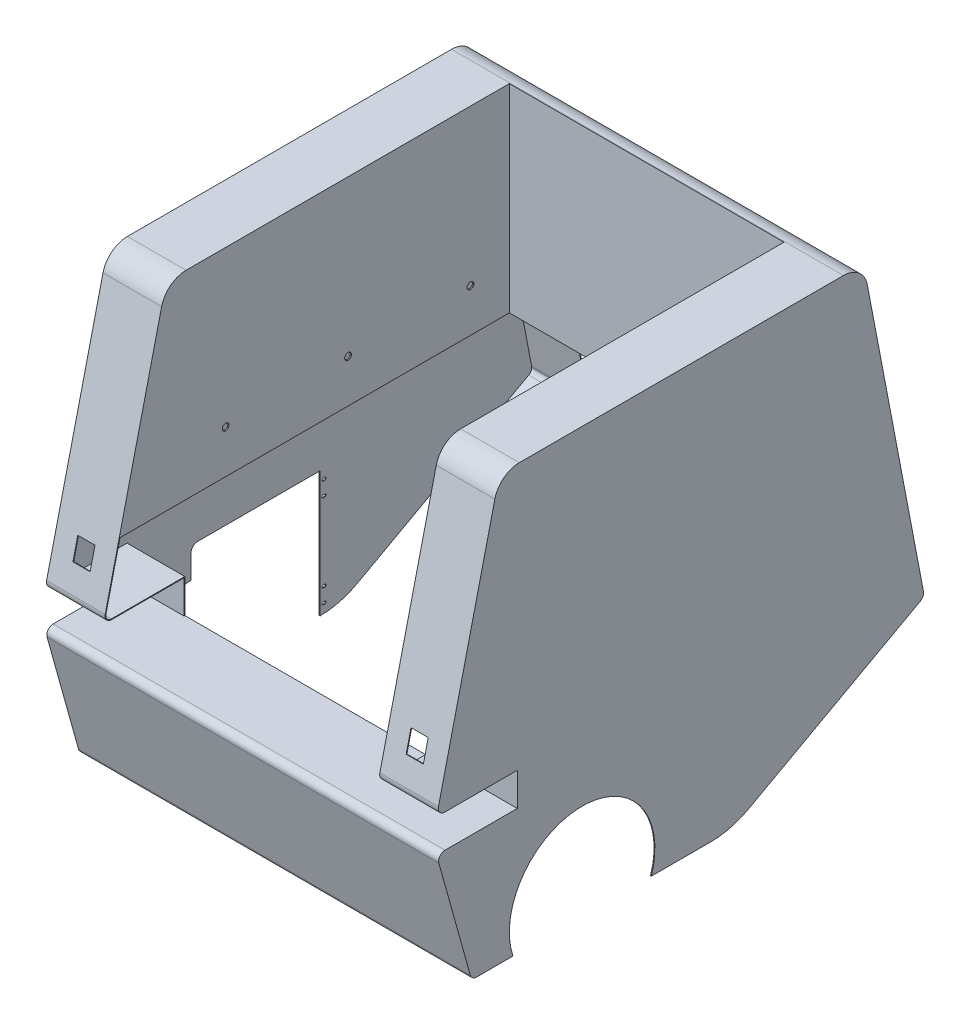
from build123d import *
from build123d.topology import SkipClean

# Parameters (mm, degrees)
EXTRUDE_1_DEPTH                  = 640
SHELL_1_T                        = 1.2
CUT_EXTRUDE_1_REACH              = 962.331
EXTRUDE_START                    = 590
EXTRUDE_2_DEPTH                  = 590
CUT_EXTRUDE_2_DEPTH              = 1.2
CUT_EXTRUDE_3_REACH              = 961.835
SKETCH_5_R                       = 110
SKETCH_6_W                       = 415.2
SKETCH_6_H                       = 302.2
CUT_EXTRUDE_4_DEPTH              = 627.8
SKETCH_7_W                       = 415.2
SKETCH_7_H                       = 2.4
EXTRUDE_3_DEPTH                  = 591.557827
CUT_EXTRUDE_5_DEPTH              = 812.221810018
CUT_EXTRUDE_5_DEPTH_BACK         = 812.221810018
SKETCH_10_W                      = 415.2
SKETCH_10_H                      = 1.2
EXTRUDE_4_DEPTH                  = 299.8
EXTRUDE_START_2                  = -2.4
SKETCH_10_3_W                    = 1.2
SKETCH_10_3_H                    = 490
EXTRUDE_7_DEPTH                  = 301
EXTRUDE_8_DEPTH                  = 1.2
SKETCH_15_W                      = 420
SKETCH_15_H                      = 239.052703248
CUT_EXTRUDE_6_DEPTH              = 132.2
SKETCH_18_W                      = 415.2
SKETCH_18_H                      = 626.6
CUT_EXTRUDE_7_DEPTH              = 151.4
CUT_EXTRUDE_8_REACH              = 961.835
CUT_EXTRUDE_9_REACH              = 984.925
SKETCH_20_W                      = 420
SKETCH_20_H                      = 0.229458581
CUT_EXTRUDE_10_REACH             = 984.925
CUT_EXTRUDE_11_REACH             = 984.925
CUT_EXTRUDE_14_REACH             = 996.76
CUT_EXTRUDE_15_REACH             = 909.833
CUT_EXTRUDE_15_DIRECTION_2_REACH = 909.833


# Read off the part's stored shape, not the designer's step: M5 접시 머리 나사용 카운터싱크1
with BuildPart() as part:
    # 스케치1 → 보스-돌출1 (new body)
    with BuildSketch(Plane(origin=(0, 0, 0), x_dir=(1, 0, 0), z_dir=(0, 1, 0))):
        Polygon((-295, 336), (-295, -336), (295, -336), (295, 336), (295, 399), (-295, 399), align=None)
    extrude(amount=EXTRUDE_1_DEPTH)

    # 쉘1
    shell_1_openings = [part.faces().sort_by_distance(p)[0] for p in [
        (0, 0, -31.5),
    ]]
    offset(amount=SHELL_1_T, openings=shell_1_openings, kind=Kind.INTERSECTION)

    # 스케치2 → 컷-돌출1 (cut, up to next)
    with BuildSketch(Plane(origin=(296.2, 0, 0), x_dir=(0, 0, -1), z_dir=(1, 0, 0)), mode=Mode.PRIVATE) as cut_extrude_1_sk1:
        with BuildLine():
            Line((-337.2, 0), (-276.86455402, 0))
            ThreePointArc((-276.86455402, 0), (-282.70692611, 1.966564113), (-286.170957947, 7.065698302))
            Line((-286.170957947, 7.065698302), (-333.780749054, 177.742307929))
            ThreePointArc((-333.780749054, 177.742307929), (-332.169476201, 186.180676903), (-324.474345127, 190))
            Line((-324.474345127, 190), (-215.2, 190))
            Line((-215.2, 190), (-215.2, 240))
            Line((-215.2, 240), (-324.983347106, 240))
            ThreePointArc((-324.983347106, 240), (-332.561522942, 243.668398525), (-334.385062863, 251.887923992))
            Line((-334.385062863, 251.887923992), (-249.112541007, 612.007247872))
            ThreePointArc((-249.112541007, 612.007247872), (-235.7305783, 633.019791681), (-212.2, 641.2))
            Line((-212.2, 641.2), (-337.2, 641.2))
            Line((-337.2, 641.2), (-337.2, 0))
        make_face()
    cut_extrude_1_tool1 = extrude(cut_extrude_1_sk1.sketch, amount=-CUT_EXTRUDE_1_REACH, mode=Mode.PRIVATE) & part.part
    # 스케치2 → 컷-돌출1 (cut, up to next)
    with BuildSketch(Plane(origin=(296.2, 0, 0), x_dir=(0, 0, -1), z_dir=(1, 0, 0)), mode=Mode.PRIVATE) as cut_extrude_1_sk2:
        with BuildLine():
            ThreePointArc((134.117581208, 14.40086523), (106.864819251, 3.657218987), (77.8, 0))
            Line((77.8, 0), (400.2, 0))
            Line((400.2, 0), (400.2, 641.2))
            Line((400.2, 641.2), (277.8, 641.2))
            ThreePointArc((277.8, 641.2), (301.217923614, 632.771933562), (313.894196537, 611.353634026))
            Line((313.894196537, 611.353634026), (398.832004547, 167.154208573))
            ThreePointArc((398.832004547, 167.154208573), (398.054971056, 161.011376377), (393.810244486, 156.503553755))
            Line((393.810244486, 156.503553755), (134.117581208, 14.40086523))
        make_face()
    cut_extrude_1_tool2 = extrude(cut_extrude_1_sk2.sketch, amount=-CUT_EXTRUDE_1_REACH, mode=Mode.PRIVATE) & part.part
    add(cut_extrude_1_tool1.solids().sort_by_distance((296.2, 638.143736, 239.782915))[0], mode=Mode.SUBTRACT)
    add(cut_extrude_1_tool2.solids().sort_by_distance((296.2, 7.176902, -239))[0], mode=Mode.SUBTRACT)

    # 스케치3 → 보스-돌출2 (add)
    with SkipClean():  # the faces are left unmerged after this step: merging them gives an invalid solid
        with BuildSketch(Plane(origin=(-295, 0, 0), x_dir=(0, 0, -1), z_dir=(1, 0, 0)).offset(EXTRUDE_START)):
            with BuildLine():
                Line((-333.217352778, 251.611422352), (-247.944830922, 611.730746231))
                ThreePointArc((-247.944830922, 611.730746231), (-234.986200025, 632.078568549), (-212.2, 640))
                Line((-212.2, 640), (-221.665718242, 640))
                ThreePointArc((-221.665718242, 640), (-239.285683962, 629.824185623), (-249.112541007, 612.007247872))
                Line((-249.112541007, 612.007247872), (-334.385062863, 251.887923992))
                ThreePointArc((-334.385062863, 251.887923992), (-332.561522942, 243.668398525), (-324.983347106, 240))
                Line((-324.983347106, 240), (-215.2, 240))
                Line((-215.2, 240), (-215.2, 190))
                Line((-215.2, 190), (-324.474345127, 190))
                ThreePointArc((-324.474345127, 190), (-332.169476201, 186.180676903), (-333.780749054, 177.742307929))
                Line((-333.780749054, 177.742307929), (-286.170957947, 7.065698302))
                ThreePointArc((-286.170957947, 7.065698302), (-282.70692611, 1.966564113), (-276.86455402, 0))
                Line((-276.86455402, 0), (-276.86455402, 1.2))
                ThreePointArc((-276.86455402, 1.2), (-281.98129294, 2.922313297), (-285.015085764, 7.388125805))
                Line((-285.015085764, 7.388125805), (-332.62487687, 178.064735433))
                ThreePointArc((-332.62487687, 178.064735433), (-331.213727017, 185.455043733), (-324.474345127, 188.8))
                Line((-324.474345127, 188.8), (-214, 188.8))
                Line((-214, 188.8), (-214, 241.2))
                Line((-214, 241.2), (-324.983347106, 241.2))
                ThreePointArc((-324.983347106, 241.2), (-331.62029981, 244.4127768), (-333.217352778, 251.611422352))
            make_face()
            with BuildLine():
                Line((287.114264573, 640), (277.8, 640))
                ThreePointArc((277.8, 640), (300.453217917, 631.847149697), (312.715550721, 611.128258696))
                Line((312.715550721, 611.128258696), (397.653358731, 166.928833243))
                ThreePointArc((397.653358731, 166.928833243), (397.748498306, 166.314290682), (397.8, 165.694563586))
                Line((397.8, 165.694563586), (397.8, 164.857598061))
                ThreePointArc((397.8, 164.857598061), (396.471214792, 160.610288461), (393.234209877, 157.556257003))
                Line((393.234209877, 157.556257003), (291.705150205, 102))
                Line((291.705150205, 102), (292.281184814, 100.947296752))
                Line((292.281184814, 100.947296752), (393.810244486, 156.503553755))
                ThreePointArc((393.810244486, 156.503553755), (397.496460029, 159.986539192), (399, 164.82996155))
                Line((399, 164.82996155), (399, 165.722200097))
                ThreePointArc((399, 165.722200097), (398.941844785, 166.441236038), (398.832004547, 167.154208573))
                Line((398.832004547, 167.154208573), (313.894196537, 611.353634026))
                ThreePointArc((313.894196537, 611.353634026), (304.644657867, 629.547477669), (287.114264573, 640))
            make_face()
        extrude(amount=-EXTRUDE_2_DEPTH)

    # 스케치4 → 컷-돌출2 (cut)
    with SkipClean():  # the faces are left unmerged after this step: merging them gives an invalid solid
        with BuildSketch(Plane.ZY.offset(296.2)):
            with BuildLine():
                Line((87.2, 0), (12.586425355, 0))
                ThreePointArc((12.586425355, 0), (117.2, -76), (221.813574645, 0))
                Line((221.813574645, 0), (147.2, 0))
                Line((147.2, 0), (87.2, 0))
            make_face()
            with BuildLine():
                ThreePointArc((117.2, 144), (28.205618155, 98.652919501), (12.586425355, 0))
                Line((12.586425355, 0), (87.2, 0))
                Line((87.2, 0), (87.2, 34))
                ThreePointArc((87.2, 34), (117.2, 64), (147.2, 34))
                Line((147.2, 34), (147.2, 0))
                Line((147.2, 0), (221.813574645, 0))
                ThreePointArc((221.813574645, 0), (225.845048693, 16.787986912), (227.2, 34))
                ThreePointArc((227.2, 34), (194.981745931, 111.781745931), (117.2, 144))
            make_face()
            with BuildLine():
                Line((87.2, 34), (87.2, 0))
                Line((87.2, 0), (147.2, 0))
                Line((147.2, 0), (147.2, 34))
                ThreePointArc((147.2, 34), (117.2, 64), (87.2, 34))
            make_face()
            with BuildLine():
                Line((107.2, 190), (-77.8, 190))
                Line((-77.8, 190), (-77.8, 0))
                Line((-77.8, 0), (12.586425355, 0))
                ThreePointArc((12.586425355, 0), (28.205618155, 98.652919501), (117.2, 144))
                Line((117.2, 144), (117.2, 180))
                ThreePointArc((117.2, 180), (114.271067812, 187.071067812), (107.2, 190))
            make_face()
        extrude(amount=-CUT_EXTRUDE_2_DEPTH, mode=Mode.SUBTRACT)

    # 스케치5 → 컷-돌출3 (cut, up to next)
    with BuildSketch(Plane(origin=(296.2, 0, 0), x_dir=(0, 0, -1), z_dir=(1, 0, 0)), mode=Mode.PRIVATE) as cut_extrude_3_sk1:
        with Locations((-117.2, 34)):
            Circle(SKETCH_5_R)
    cut_extrude_3_tool1 = extrude(cut_extrude_3_sk1.sketch, amount=-CUT_EXTRUDE_3_REACH, mode=Mode.PRIVATE) & part.part
    add(cut_extrude_3_tool1.solids().sort_by_distance((296.2, 34, 117.2))[0], mode=Mode.SUBTRACT)

    # 스케치6 → 컷-돌출4 (cut)
    with SkipClean():  # the faces are left unmerged after this step: merging them gives an invalid solid
        with BuildSketch(Plane.XY.offset(350)):
            with Locations((0, 490.1)):
                Rectangle(SKETCH_6_W, SKETCH_6_H)
        extrude(amount=-CUT_EXTRUDE_4_DEPTH, mode=Mode.SUBTRACT)

    # 스케치7 → 보스-돌출3 (add)
    with SkipClean():  # the faces are left unmerged after this step: merging them gives an invalid solid
        with BuildSketch(Plane(origin=(0, 0, 313.75782652), x_dir=(-1, 0, 0), z_dir=(0, 0, -1))):
            with Locations((0, 340.2)):
                Rectangle(SKETCH_7_W, SKETCH_7_H)
        extrude(amount=EXTRUDE_3_DEPTH)

    # 스케치8 → 컷-돌출5 (cut, two sides: drawn at the far end of the back side and taken through both)
    with SkipClean():  # the faces are left unmerged after this step: merging them gives an invalid solid
        with BuildSketch(Plane(origin=(0, 0, 0), x_dir=(0, 0, -1), z_dir=(1, 0, 0)).offset(-CUT_EXTRUDE_5_DEPTH_BACK)):
            Polygon((-313.75782652, 341.4), (-313.75782652, 339), (-313.189531406, 341.4), align=None)
        extrude(amount=CUT_EXTRUDE_5_DEPTH + CUT_EXTRUDE_5_DEPTH_BACK, mode=Mode.SUBTRACT)

    # 스케치10 → 보스-돌출4 (add)
    with SkipClean():  # the faces are left unmerged after this step: merging them gives an invalid solid
        with BuildSketch(Plane(origin=(0, 341.4, 0), x_dir=(1, 0, 0), z_dir=(0, 1, 0))):
            with Locations((0, 277.2)):
                Rectangle(SKETCH_10_W, SKETCH_10_H)
        extrude(amount=EXTRUDE_4_DEPTH)

    # 스케치10<3> → 보스-돌출7 (add)
    with SkipClean():  # the faces are left unmerged after this step: merging them gives an invalid solid
        with BuildSketch(Plane(origin=(0, 341.4, 0), x_dir=(1, 0, 0), z_dir=(0, 1, 0)).offset(EXTRUDE_START_2)):
            with Locations((-208.2, 32.8)):
                Rectangle(SKETCH_10_3_W, SKETCH_10_3_H)
            with Locations((208.2, 32.8)):
                Rectangle(SKETCH_10_3_W, SKETCH_10_3_H)
        extrude(amount=EXTRUDE_7_DEPTH)

    # 스케치30 → 보스-돌출8 (add)
    with SkipClean():  # the faces are left unmerged after this step: merging them gives an invalid solid
        with BuildSketch(Plane(origin=(-207.6, 0, 0), x_dir=(0, 0, -1), z_dir=(1, 0, 0))):
            with BuildLine():
                Line((-247.944830922, 611.730746231), (-312.524643714, 339))
                Line((-312.524643714, 339), (-212.2, 339))
                Line((-212.2, 339), (-212.2, 640))
                ThreePointArc((-212.2, 640), (-234.986200025, 632.078568549), (-247.944830922, 611.730746231))
            make_face()
        extrude_8 = extrude(amount=-EXTRUDE_8_DEPTH)

    # 대칭 복사2: 보스-돌출8 across plane
    with SkipClean():  # the faces are left unmerged after this step: merging them gives an invalid solid
        add(extrude_8.mirror(Plane(origin=(0, 0, 0), x_dir=(0, 0, 1), z_dir=(1, 0, 0))))

    # 스케치15 → 컷-돌출6 (cut)
    with SkipClean():  # the faces are left unmerged after this step: merging them gives an invalid solid
        with BuildSketch(Plane.XY.offset(-410)):
            with Locations((0, 220.473648376)):
                Rectangle(SKETCH_15_W, SKETCH_15_H)
        extrude(amount=CUT_EXTRUDE_6_DEPTH, mode=Mode.SUBTRACT)

    # 스케치18 → 컷-돌출7 (cut)
    with SkipClean():  # the faces are left unmerged after this step: merging them gives an invalid solid
        with BuildSketch(Plane(origin=(0, 341.4, 0), x_dir=(1, 0, 0), z_dir=(0, 1, 0))):
            with Locations((0, -36.7)):
                Rectangle(SKETCH_18_W, SKETCH_18_H)
        extrude(amount=-CUT_EXTRUDE_7_DEPTH, mode=Mode.SUBTRACT)

    # 스케치19 → 컷-돌출8 (cut, up to next)
    with BuildSketch(Plane.ZY.offset(296.2), mode=Mode.PRIVATE) as cut_extrude_8_sk1:
        with BuildLine():
            Line((-84.8, 178), (-82.8, 178))
            ThreePointArc((-82.8, 178), (-80.8, 176), (-82.8, 174))
            Line((-82.8, 174), (-84.8, 174))
            ThreePointArc((-84.8, 174), (-86.8, 176), (-84.8, 178))
        make_face()
    cut_extrude_8_tool1 = extrude(cut_extrude_8_sk1.sketch, amount=-CUT_EXTRUDE_8_REACH, mode=Mode.PRIVATE) & part.part
    # 스케치19 → 컷-돌출8 (cut, up to next)
    with BuildSketch(Plane.ZY.offset(296.2), mode=Mode.PRIVATE) as cut_extrude_8_sk2:
        with BuildLine():
            Line((-82.8, 156), (-84.8, 156))
            ThreePointArc((-84.8, 156), (-86.8, 154), (-84.8, 152))
            Line((-84.8, 152), (-82.8, 152))
            ThreePointArc((-82.8, 152), (-80.8, 154), (-82.8, 156))
        make_face()
    cut_extrude_8_tool2 = extrude(cut_extrude_8_sk2.sketch, amount=-CUT_EXTRUDE_8_REACH, mode=Mode.PRIVATE) & part.part
    # 스케치19 → 컷-돌출8 (cut, up to next)
    with BuildSketch(Plane.ZY.offset(296.2), mode=Mode.PRIVATE) as cut_extrude_8_sk3:
        with BuildLine():
            Line((-84.8, 38), (-82.8, 38))
            ThreePointArc((-82.8, 38), (-80.8, 36), (-82.8, 34))
            Line((-82.8, 34), (-84.8, 34))
            ThreePointArc((-84.8, 34), (-86.8, 36), (-84.8, 38))
        make_face()
    cut_extrude_8_tool3 = extrude(cut_extrude_8_sk3.sketch, amount=-CUT_EXTRUDE_8_REACH, mode=Mode.PRIVATE) & part.part
    # 스케치19 → 컷-돌출8 (cut, up to next)
    with BuildSketch(Plane.ZY.offset(296.2), mode=Mode.PRIVATE) as cut_extrude_8_sk4:
        with BuildLine():
            Line((-82.8, 16), (-84.8, 16))
            ThreePointArc((-84.8, 16), (-86.8, 14), (-84.8, 12))
            Line((-84.8, 12), (-82.8, 12))
            ThreePointArc((-82.8, 12), (-80.8, 14), (-82.8, 16))
        make_face()
    cut_extrude_8_tool4 = extrude(cut_extrude_8_sk4.sketch, amount=-CUT_EXTRUDE_8_REACH, mode=Mode.PRIVATE) & part.part
    add(cut_extrude_8_tool1.solids().sort_by_distance((-296.2, 176, -83.8))[0], mode=Mode.SUBTRACT)
    add(cut_extrude_8_tool2.solids().sort_by_distance((-296.2, 154, -83.8))[0], mode=Mode.SUBTRACT)
    add(cut_extrude_8_tool3.solids().sort_by_distance((-296.2, 36, -83.8))[0], mode=Mode.SUBTRACT)
    add(cut_extrude_8_tool4.solids().sort_by_distance((-296.2, 14, -83.8))[0], mode=Mode.SUBTRACT)

    # 스케치20 → 컷-돌출9 (cut, up to next)
    with BuildSketch(Plane(origin=(0, 79.46892343, -415.598788762), x_dir=(-1, 0, 0), z_dir=(0, 0.1878127749483022, -0.9822048470488315)), mode=Mode.PRIVATE) as cut_extrude_9_sk1:
        with Locations((0, 265.365992663)):
            Rectangle(SKETCH_20_W, SKETCH_20_H)
    cut_extrude_9_tool1 = extrude(cut_extrude_9_sk1.sketch, amount=-CUT_EXTRUDE_9_REACH, mode=Mode.PRIVATE) & part.part
    add(cut_extrude_9_tool1.solids().sort_by_distance((0, 340.112688, -365.759665))[0], mode=Mode.SUBTRACT)

    # 스케치21 → 컷-돌출10 (cut, up to next)
    with BuildSketch(Plane(origin=(0, 79.46892343, -415.598788762), x_dir=(-1, 0, 0), z_dir=(0, 0.1878127749483022, -0.9822048470488315)), mode=Mode.PRIVATE) as cut_extrude_10_sk1:
        with BuildLine():
            Line((-184, 270.480721953), (-184, 272.480721953))
            ThreePointArc((-184, 272.480721953), (-186, 274.480721953), (-188, 272.480721953))
            Line((-188, 272.480721953), (-188, 270.480721953))
            ThreePointArc((-188, 270.480721953), (-186, 268.480721953), (-184, 270.480721953))
        make_face()
    cut_extrude_10_tool1 = extrude(cut_extrude_10_sk1.sketch, amount=-CUT_EXTRUDE_10_REACH, mode=Mode.PRIVATE) & part.part
    # 스케치21 → 컷-돌출10 (cut, up to next)
    with BuildSketch(Plane(origin=(0, 79.46892343, -415.598788762), x_dir=(-1, 0, 0), z_dir=(0, 0.1878127749483022, -0.9822048470488315)), mode=Mode.PRIVATE) as cut_extrude_10_sk2:
        with BuildLine():
            ThreePointArc((-162, 270.480721953), (-164, 268.480721953), (-166, 270.480721953))
            Line((-166, 270.480721953), (-166, 272.480721953))
            ThreePointArc((-166, 272.480721953), (-164, 274.480721953), (-162, 272.480721953))
            Line((-162, 272.480721953), (-162, 270.480721953))
        make_face()
    cut_extrude_10_tool2 = extrude(cut_extrude_10_sk2.sketch, amount=-CUT_EXTRUDE_10_REACH, mode=Mode.PRIVATE) & part.part
    # 스케치21 → 컷-돌출10 (cut, up to next)
    with BuildSketch(Plane(origin=(0, 79.46892343, -415.598788762), x_dir=(-1, 0, 0), z_dir=(0, 0.1878127749483022, -0.9822048470488315)), mode=Mode.PRIVATE) as cut_extrude_10_sk3:
        with BuildLine():
            Line((166, 270.480721953), (166, 272.480721953))
            ThreePointArc((166, 272.480721953), (164, 274.480721953), (162, 272.480721953))
            Line((162, 272.480721953), (162, 270.480721953))
            ThreePointArc((162, 270.480721953), (164, 268.480721953), (166, 270.480721953))
        make_face()
    cut_extrude_10_tool3 = extrude(cut_extrude_10_sk3.sketch, amount=-CUT_EXTRUDE_10_REACH, mode=Mode.PRIVATE) & part.part
    # 스케치21 → 컷-돌출10 (cut, up to next)
    with BuildSketch(Plane(origin=(0, 79.46892343, -415.598788762), x_dir=(-1, 0, 0), z_dir=(0, 0.1878127749483022, -0.9822048470488315)), mode=Mode.PRIVATE) as cut_extrude_10_sk4:
        with BuildLine():
            ThreePointArc((188, 270.480721953), (186, 268.480721953), (184, 270.480721953))
            Line((184, 270.480721953), (184, 272.480721953))
            ThreePointArc((184, 272.480721953), (186, 274.480721953), (188, 272.480721953))
            Line((188, 272.480721953), (188, 270.480721953))
        make_face()
    cut_extrude_10_tool4 = extrude(cut_extrude_10_sk4.sketch, amount=-CUT_EXTRUDE_10_REACH, mode=Mode.PRIVATE) & part.part
    add(cut_extrude_10_tool1.solids().sort_by_distance((186, 346.118604, -364.611241))[0], mode=Mode.SUBTRACT)
    add(cut_extrude_10_tool2.solids().sort_by_distance((164, 346.118604, -364.611241))[0], mode=Mode.SUBTRACT)
    add(cut_extrude_10_tool3.solids().sort_by_distance((-164, 346.118604, -364.611241))[0], mode=Mode.SUBTRACT)
    add(cut_extrude_10_tool4.solids().sort_by_distance((-186, 346.118604, -364.611241))[0], mode=Mode.SUBTRACT)

    # 스케치22 → 컷-돌출11 (cut, up to next)
    with BuildSketch(Plane(origin=(0, 79.46892343, -415.598788762), x_dir=(-1, 0, 0), z_dir=(0, 0.1878127749483022, -0.9822048470488315)), mode=Mode.PRIVATE) as cut_extrude_11_sk1:
        Polygon((4.849742261, 491.52116251), (2.424871131, 495.72116251), (-2.424871131, 495.72116251), (-4.849742261, 491.52116251), (-2.424871131, 487.32116251), (2.424871131, 487.32116251), align=None)
    cut_extrude_11_tool1 = extrude(cut_extrude_11_sk1.sketch, amount=-CUT_EXTRUDE_11_REACH, mode=Mode.PRIVATE) & part.part
    add(cut_extrude_11_tool1.solids().sort_by_distance((0, 562.243392, -323.284835))[0], mode=Mode.SUBTRACT)

    # M5 접시 머리 나사용 카운터싱크1 outline → M5 접시 머리 나사용 카운터싱크1 (revolve, cut)
    with SkipClean():  # the faces are left unmerged after this step: merging them gives an invalid solid
        with BuildSketch(Plane(origin=(0, 406, 152.2), x_dir=(0, 1, 0), z_dir=(0, 0, -1))):
            Polygon((0, 207.6), (5.2, 207.6), (5.2, 207.9), (4.3, 208.8), (0, 208.8), align=None)
        hole_wizard_m5_1 = revolve(axis=Axis((0, 406, 152.2), (1, 0, 0)), mode=Mode.SUBTRACT)

    # Hole Wizard M5 _ _ _ _1 2 outline → Hole Wizard M5 _ _ _ _1 2 (revolve, cut)
    with SkipClean():  # the faces are left unmerged after this step: merging them gives an invalid solid
        with BuildSketch(Plane(origin=(0, 406, -32.8), x_dir=(0, 1, 0), z_dir=(0, 0, -1))):
            Polygon((0, 207.6), (5.2, 207.6), (5.2, 207.9), (4.3, 208.8), (0, 208.8), align=None)
        hole_wizard_m5_1_2 = revolve(axis=Axis((0, 406, -32.8), (1, 0, 0)), mode=Mode.SUBTRACT)

    # Hole Wizard M5 _ _ _ _1 3 outline → Hole Wizard M5 _ _ _ _1 3 (revolve, cut)
    with SkipClean():  # the faces are left unmerged after this step: merging them gives an invalid solid
        with BuildSketch(Plane(origin=(0, 406, -217.8), x_dir=(0, 1, 0), z_dir=(0, 0, -1))):
            Polygon((0, 207.6), (5.2, 207.6), (5.2, 207.9), (4.3, 208.8), (0, 208.8), align=None)
        hole_wizard_m5_1_3 = revolve(axis=Axis((0, 406, -217.8), (1, 0, 0)), mode=Mode.SUBTRACT)

    # 대칭 복사3: M5 접시 머리 나사용 카운터싱크1, Hole Wizard M5 _ _ _ _1 2, Hole Wizard M5 _ _ _ _1 3 across plane
    with SkipClean():  # the faces are left unmerged after this step: merging them gives an invalid solid
        add(hole_wizard_m5_1.mirror(Plane(origin=(0, 0, 0), x_dir=(0, 0, 1), z_dir=(1, 0, 0))), mode=Mode.SUBTRACT)
        add(hole_wizard_m5_1_2.mirror(Plane(origin=(0, 0, 0), x_dir=(0, 0, 1), z_dir=(1, 0, 0))), mode=Mode.SUBTRACT)
        add(hole_wizard_m5_1_3.mirror(Plane(origin=(0, 0, 0), x_dir=(0, 0, 1), z_dir=(1, 0, 0))), mode=Mode.SUBTRACT)

    # 스케치27 → 컷-돌출14 (cut, up to next)
    with BuildSketch(Plane(origin=(0, 88.34846356, 373.10951137), x_dir=(1, 0, 0), z_dir=(0, 0.23041803358111462, 0.9730917376078232)), mode=Mode.PRIVATE) as cut_extrude_14_sk1:
        Polygon((264.9, 236.861708996), (264.9, 231.861708996), (264.9, 204.861708996), (238.9, 204.861708996), (238.9, 231.861708996), (238.9, 236.861708996), align=None)
    cut_extrude_14_tool1 = extrude(cut_extrude_14_sk1.sketch, amount=-CUT_EXTRUDE_14_REACH, mode=Mode.PRIVATE) & part.part
    cut_extrude_14 = cut_extrude_14_tool1.solids().sort_by_distance((251.9, 303.267168, 322.218991))[0]
    add(cut_extrude_14, mode=Mode.SUBTRACT)

    # 대칭 복사4: 컷-돌출14 across plane
    with SkipClean():  # the faces are left unmerged after this step: merging them gives an invalid solid
        add(cut_extrude_14.mirror(Plane(origin=(0, 0, 0), x_dir=(0, 0, 1), z_dir=(1, 0, 0))), mode=Mode.SUBTRACT)

    # 스케치35 → 컷-돌출15 (cut, up to next)
    with BuildSketch(Plane(origin=(-207.6, 0, 0), x_dir=(0, 0, -1), z_dir=(1, 0, 0)), mode=Mode.PRIVATE) as cut_extrude_15_sk1:
        Polygon((-312.051064452, 341), (-312.524643714, 339), (277.8, 339), (277.8, 341), align=None)
    cut_extrude_15_tool1 = extrude(cut_extrude_15_sk1.sketch, amount=-CUT_EXTRUDE_15_REACH, mode=Mode.PRIVATE) & part.part
    add(cut_extrude_15_tool1.solids().sort_by_distance((-207.6, 339.999866, 17.243943))[0], mode=Mode.SUBTRACT)

    # 스케치35 → 컷-돌출15 direction 2 (cut, up to next)
    with BuildSketch(Plane(origin=(-207.6, 0, 0), x_dir=(0, 0, -1), z_dir=(1, 0, 0)), mode=Mode.PRIVATE) as cut_extrude_15_direction_2_sk1:
        Polygon((-312.051064452, 341), (-312.524643714, 339), (277.8, 339), (277.8, 341), align=None)
    cut_extrude_15_direction_2_tool1 = extrude(cut_extrude_15_direction_2_sk1.sketch, amount=CUT_EXTRUDE_15_DIRECTION_2_REACH, mode=Mode.PRIVATE) & part.part
    add(cut_extrude_15_direction_2_tool1.solids().sort_by_distance((-207.6, 339.999866, 17.243943))[0], mode=Mode.SUBTRACT)


solid = part.part
